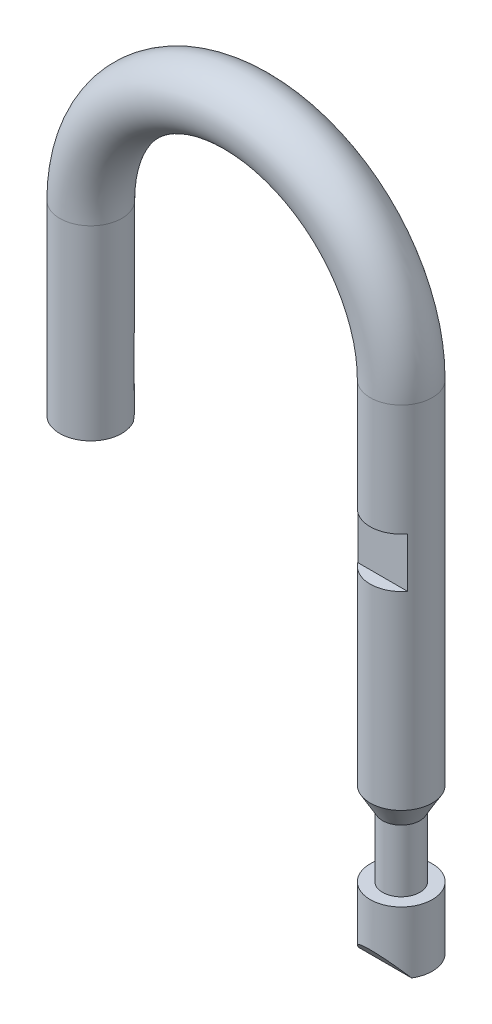
from build123d import *

# Parameters (mm, degrees)
SKETCH_3_R          = 2.5
SKETCH_4_W          = 7.512886461
SKETCH_4_H          = 4
CUT_EXTRUDE_1_DEPTH = 10
CUT_EXTRUDE_START   = 10
SKETCH_4_3_W        = 9.374325773
SKETCH_4_3_H        = 4
CUT_EXTRUDE_2_DEPTH = 40.56056908
CUT_EXTRUDE_START_2 = -5
SKETCH_5_R          = 2.5
SKETCH_5_R_2        = 1.5
CUT_EXTRUDE_3_DEPTH = 5
CHAMFER_1_SIZE2     = 1
CHAMFER_1_SIZE      = 1.732050808


with BuildPart() as part:
    # 스윕1: sweep along a path in 스케치2
    with BuildLine(Plane.XY) as sweep_1_path:
        Line((7.5, -10), (7.5, 5))
        ThreePointArc((7.5, 5), (20, 17.5), (32.5, 5))
        Line((32.5, 5), (32.5, -35))
    # 스케치3 → 스윕1 (sweep)
    with BuildSketch(Plane(origin=(0, 0, 0), x_dir=(1, 0, 0), z_dir=(0, 1, 0))):
        with Locations((7.5, 0)):
            Circle(SKETCH_3_R)
    sweep(path=sweep_1_path.line)

    # 스케치4 → 컷-돌출1 (cut)
    with BuildSketch(Plane(origin=(0, 0, 0), x_dir=(0, 0, -1), z_dir=(1, 0, 0))):
        with Locations((5.256443231, -6)):
            Rectangle(SKETCH_4_W, SKETCH_4_H)
        Polygon((2.5, -10), (2.5, -8.5), (1.3, -10), align=None)
    extrude(amount=CUT_EXTRUDE_1_DEPTH, mode=Mode.SUBTRACT)

    # 스케치4<3> → 컷-돌출2 (cut, through all)
    with BuildSketch(Plane(origin=(0, 0, 0), x_dir=(0, 0, -1), z_dir=(1, 0, 0)).offset(CUT_EXTRUDE_START)):
        with Locations((-6.187162887, -6)):
            Rectangle(SKETCH_4_3_W, SKETCH_4_3_H)
        Polygon((-1.3, -35), (-2.5, -35), (-2.5, -33.5), align=None)
    extrude(amount=CUT_EXTRUDE_2_DEPTH, mode=Mode.SUBTRACT)

    # 스케치5 → 컷-돌출3 (cut)
    with BuildSketch(Plane.XZ.offset(35).offset(CUT_EXTRUDE_START_2)):
        with Locations((32.5, 0)):
            Circle(SKETCH_5_R)
        with Locations((32.5, 0)):
            Circle(SKETCH_5_R_2, mode=Mode.SUBTRACT)
    extrude(amount=-CUT_EXTRUDE_3_DEPTH, mode=Mode.SUBTRACT)

    # 모따기1
    chamfer_1_edges = [part.edges().sort_by_distance(p)[0] for p in [
        (35, -25, 0),
    ]]
    chamfer_1_side = [part.faces().sort_by_distance(p)[0] for p in [
        (35, -24.98, 0),
    ]]
    chamfer(chamfer_1_edges, length=CHAMFER_1_SIZE - 0.0001, length2=CHAMFER_1_SIZE2 - 0.0001, reference=chamfer_1_side[0])  # a hair under: the kernel refuses the full size


solid = part.part
